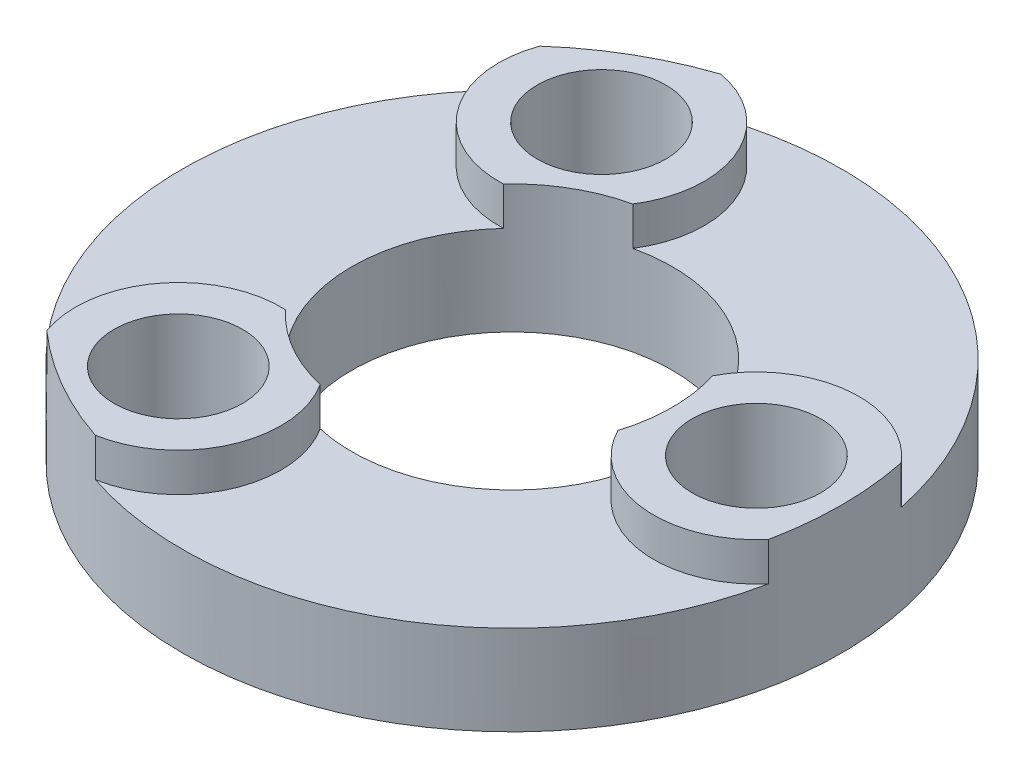
from build123d import *

# Parameters (mm, degrees)
SKETCH1_R           = 25.7
SKETCH1_R_2         = 12.5
BOSS_EXTRUDE1_DEPTH = 10
SKETCH3_R           = 5.0125
CUT_EXTRUDE1_DEPTH  = 7.5
CIRPATTERN1_COUNT   = 3
CUT_EXTRUDE2_START  = -3
CUT_EXTRUDE2_DEPTH  = 3


with BuildPart() as part:
    # Sketch1 → Boss-Extrude1 (new body)
    with BuildSketch(Plane(origin=(0, 0, 0), x_dir=(1, 0, 0), z_dir=(0, 1, 0))):
        Circle(SKETCH1_R)
        Circle(SKETCH1_R_2, mode=Mode.SUBTRACT)
    extrude(amount=BOSS_EXTRUDE1_DEPTH)

    # Sketch3 → Cut-Extrude1 (cut)
    with BuildSketch(Plane(origin=(0, 10, 0), x_dir=(1, 0, 0), z_dir=(0, 1, 0))):
        with Locations((19.0525, 0)):
            Circle(SKETCH3_R)
    cut_extrude1 = extrude(amount=-CUT_EXTRUDE1_DEPTH, mode=Mode.SUBTRACT)

    # CirPattern1: Cut-Extrude1 ×3 about axis
    cirpattern1_axis = Axis((0, 0, 0), (0, 1, 0))
    for i in range(1, CIRPATTERN1_COUNT):
        add(cut_extrude1.rotate(cirpattern1_axis, i * 360 / CIRPATTERN1_COUNT), mode=Mode.SUBTRACT)

    # Sketch6 → Cut-Extrude2 (cut)
    with BuildSketch(Plane(origin=(0, 10, 0), x_dir=(1, 0, 0), z_dir=(0, 1, 0)).offset(CUT_EXTRUDE2_START)):
        with BuildLine():
            ThreePointArc((-17.063779249, 19.21763351), (-15.978550242, 11.749372426), (-9.169416643, 8.495398662))
            ThreePointArc((-9.169416643, 8.495398662), (-12.5, 0), (-9.169416643, -8.495398662))
            ThreePointArc((-9.169416643, -8.495398662), (-15.978550242, -11.749372426), (-17.063779249, -19.21763351))
            ThreePointArc((-17.063779249, -19.21763351), (-25.7, 0), (-17.063779249, 19.21763351))
        make_face()
        with BuildLine():
            ThreePointArc((11.941939378, -3.69324842), (18.16453012, -7.963144212), (25.174848445, -5.168849559))
            ThreePointArc((25.174848445, -5.168849559), (12.85, -22.256852877), (-8.111069196, -24.38648307))
            ThreePointArc((-8.111069196, -24.38648307), (-2.185979878, -19.712516638), (-2.772522735, -12.188647082))
            ThreePointArc((-2.772522735, -12.188647082), (6.25, -10.825317547), (11.941939378, -3.69324842))
        make_face()
        with BuildLine():
            ThreePointArc((-2.772522735, 12.188647082), (-2.185979878, 19.712516638), (-8.111069196, 24.38648307))
            ThreePointArc((-8.111069196, 24.38648307), (12.85, 22.256852877), (25.174848445, 5.168849559))
            ThreePointArc((25.174848445, 5.168849559), (18.16453012, 7.963144212), (11.941939378, 3.69324842))
            ThreePointArc((11.941939378, 3.69324842), (6.25, 10.825317547), (-2.772522735, 12.188647082))
        make_face()
    extrude(amount=CUT_EXTRUDE2_DEPTH, mode=Mode.SUBTRACT)


solid = part.part
